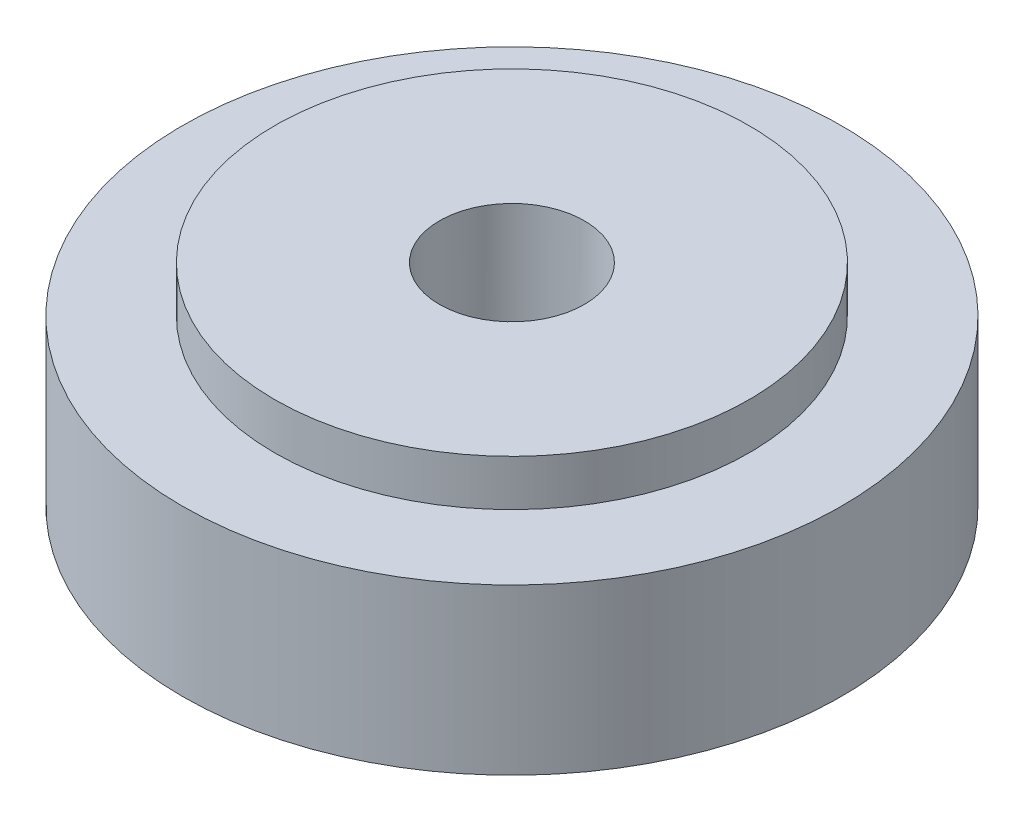
from build123d import *

# Parameters (mm, degrees)
SKETCH_1_R          = 5
EXTRUDE_1_DEPTH     = 2.5
SKETCH_2_R          = 3.6
EXTRUDE_2_DEPTH     = 0.7
SKETCH_3_R          = 1.1
CUT_EXTRUDE_1_DEPTH = 8.761443165
SKETCH_4_R          = 1.9
CUT_EXTRUDE_2_DEPTH = 1.2


with BuildPart() as part:
    # 草图1 → 凸台-拉伸1 (new body)
    with BuildSketch(Plane(origin=(0, 0, 0), x_dir=(1, 0, 0), z_dir=(0, 1, 0))):
        Circle(SKETCH_1_R)
    extrude(amount=EXTRUDE_1_DEPTH)

    # 草图2 → 凸台-拉伸2 (add)
    with BuildSketch(Plane(origin=(0, 2.5, 0), x_dir=(1, 0, 0), z_dir=(0, 1, 0))):
        Circle(SKETCH_2_R)
    extrude(amount=EXTRUDE_2_DEPTH)

    # 草图3 → 切除-拉伸1 (cut, through all)
    with BuildSketch(Plane(origin=(0, 3.2, 0), x_dir=(1, 0, 0), z_dir=(0, 1, 0))):
        Circle(SKETCH_3_R)
    extrude(amount=-CUT_EXTRUDE_1_DEPTH, mode=Mode.SUBTRACT)

    # 草图4 → 切除-拉伸2 (cut)
    with BuildSketch(Plane.XZ):
        Circle(SKETCH_4_R)
    extrude(amount=-CUT_EXTRUDE_2_DEPTH, mode=Mode.SUBTRACT)


solid = part.part
